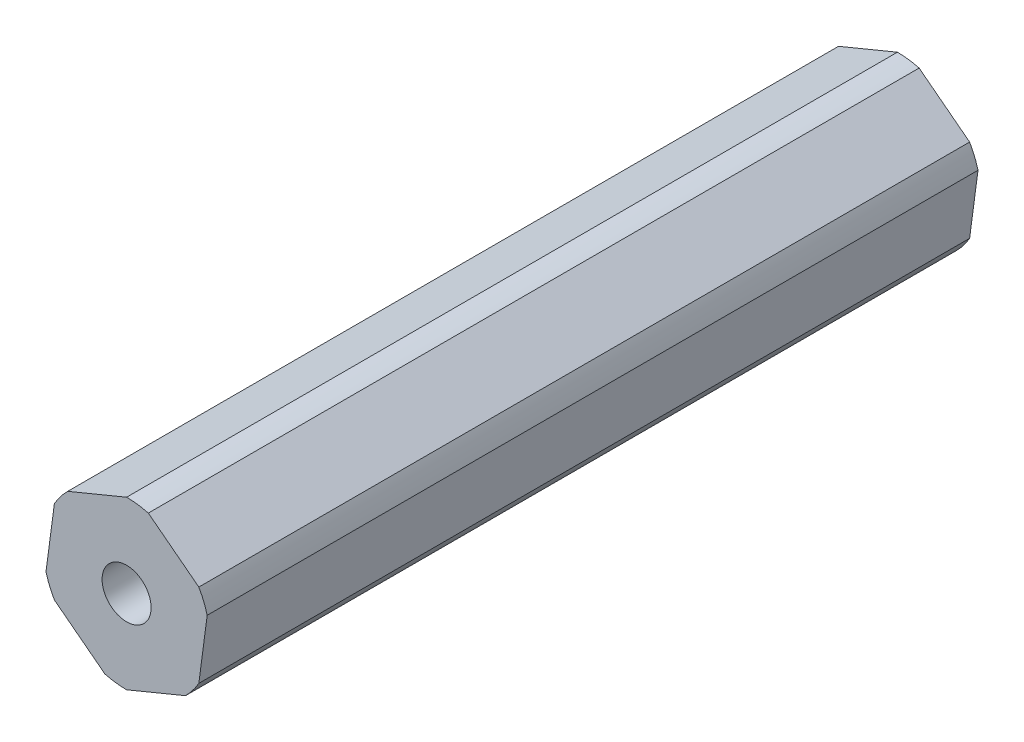
from build123d import *

# Parameters (mm, degrees)
BOSS_EXTRUDE1_DEPTH        = 63.5
F_10_32_TAPPED_HOLE1_D     = 4.0386
F_10_32_TAPPED_HOLE1_DEPTH = 12.0396
F_10_32_TAPPED_HOLE1_TIP   = 1.213317848
F_10_32_TAPPED_HOLE2_D     = 4.0386
F_10_32_TAPPED_HOLE2_DEPTH = 12.0396
F_10_32_TAPPED_HOLE2_TIP   = 1.213317848


with BuildPart() as part:
    # Sketch1 → Boss-Extrude1 (new body)
    with BuildSketch(Plane.XY):
        with BuildLine():
            Line((5.950200742, 3.43535), (1.789892893, 6.63346078))
            ThreePointArc((1.789892893, 6.63346078), (0.902773368, 6.811131972), (0, 6.8707))
            Line((0, 6.8707), (-4.849799104, 4.866823105))
            ThreePointArc((-4.849799104, 4.866823105), (-5.447226632, 4.187390656), (-5.950200742, 3.43535))
            Line((-5.950200742, 3.43535), (-6.639691997, -1.766637675))
            ThreePointArc((-6.639691997, -1.766637675), (-6.35, -2.623741315), (-5.950200742, -3.43535))
            Line((-5.950200742, -3.43535), (-1.789892893, -6.63346078))
            ThreePointArc((-1.789892893, -6.63346078), (-0.902773368, -6.811131972), (0, -6.8707))
            Line((0, -6.8707), (4.849799104, -4.866823105))
            ThreePointArc((4.849799104, -4.866823105), (5.447226632, -4.187390656), (5.950200742, -3.43535))
            Line((5.950200742, -3.43535), (6.639691997, 1.766637675))
            ThreePointArc((6.639691997, 1.766637675), (6.35, 2.623741315), (5.950200742, 3.43535))
        make_face()
    extrude(amount=BOSS_EXTRUDE1_DEPTH)

    # #10-32 Tapped Hole1
    with Locations(Plane.XY.offset(63.5)):
        with Locations((0, 0)):
            Hole(F_10_32_TAPPED_HOLE1_D / 2, depth=F_10_32_TAPPED_HOLE1_DEPTH)
            with Locations((0, 0, -(F_10_32_TAPPED_HOLE1_DEPTH + F_10_32_TAPPED_HOLE1_TIP / 2))):  # 118° drill point
                Cone(0, F_10_32_TAPPED_HOLE1_D / 2, F_10_32_TAPPED_HOLE1_TIP, mode=Mode.SUBTRACT)

    # #10-32 Tapped Hole2
    with Locations(Plane(origin=(0, 0, 0), x_dir=(-1, 0, 0), z_dir=(0, 0, -1))):
        with Locations((0, 0)):
            Hole(F_10_32_TAPPED_HOLE2_D / 2, depth=F_10_32_TAPPED_HOLE2_DEPTH)
            with Locations((0, 0, -(F_10_32_TAPPED_HOLE2_DEPTH + F_10_32_TAPPED_HOLE2_TIP / 2))):  # 118° drill point
                Cone(0, F_10_32_TAPPED_HOLE2_D / 2, F_10_32_TAPPED_HOLE2_TIP, mode=Mode.SUBTRACT)


solid = part.part
